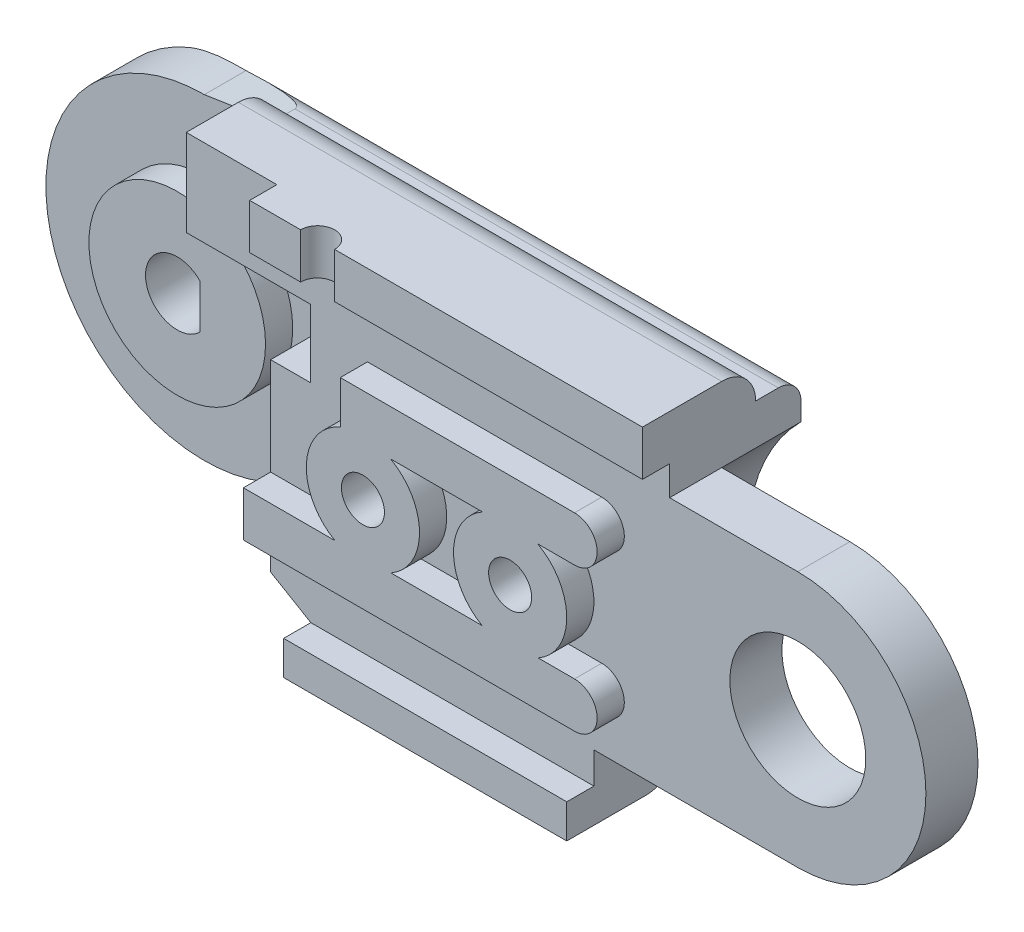
from build123d import *

# Parameters (mm, degrees)
BOSS_EXTRUDE1_DEPTH = 2
BOSS_EXTRUDE2_DEPTH = 1.5
BOSS_EXTRUDE3_DEPTH = 2.3
SKETCH6_W           = 5.48
SKETCH6_H           = 3
CUT_EXTRUDE1_DEPTH  = 3.8
SKETCH7_R           = 3
CUT_EXTRUDE2_DEPTH  = 3.3
SKETCH8_W           = 17.343145751
SKETCH8_H           = 2
SKETCH8_W_2         = 12.500252532
SKETCH8_H_2         = 1.5
BOSS_EXTRUDE4_DEPTH = 1.2
SKETCH9_R           = 2.5
BOSS_EXTRUDE5_DEPTH = 1.2
SKETCH10_R          = 0.95
CUT_EXTRUDE3_DEPTH  = 8.2
SKETCH11_R          = 2
CUT_EXTRUDE4_DEPTH  = 2.2
SKETCH12_R          = 3.9
BOSS_EXTRUDE6_DEPTH = 1.2
CUT_EXTRUDE5_DEPTH  = 3.2
FILLET1_R           = 1.5
FILLET2_R           = 1
SKETCH15_R          = 0.75
CUT_EXTRUDE6_DEPTH  = 4


with BuildPart() as part:
    # Sketch2 → Boss-Extrude1 (new body)
    with BuildSketch(Plane.XY):
        with BuildLine():
            Line((0, 7), (3, 7.456854249))
            Line((3, 7.456854249), (24.343145751, 7.456854249))
            Line((24.343145751, 7.456854249), (24.343145751, 5.656854249))
            ThreePointArc((24.343145751, 5.656854249), (22.60896374, 3.061467459), (22, 0))
            Line((22, 0), (21, -2.543145751))
            Line((21, -2.543145751), (21, -7.043145751))
            Line((21, -7.043145751), (8.499747468, -7.043145751))
            Line((8.499747468, -7.043145751), (4.949747468, -4.949747468))
            ThreePointArc((4.949747468, -4.949747468), (-6.467156728, -2.678784027), (0, 7))
        make_face()
    extrude(amount=BOSS_EXTRUDE1_DEPTH)

    # Sketch3 → Boss-Extrude2 (add)
    with BuildSketch(Plane.XY.offset(2)):
        with BuildLine():
            Line((24.343145751, 7.456854249), (24.343145751, 5.656854249))
            ThreePointArc((24.343145751, 5.656854249), (22.60896374, 3.061467459), (22, 0))
            Line((22, 0), (21, -2.543145751))
            Line((21, -2.543145751), (21, -7.043145751))
            Line((21, -7.043145751), (21, -8.543145751))
            Line((21, -8.543145751), (8.499747468, -8.543145751))
            Line((8.499747468, -8.543145751), (8.499747468, -7.043145751))
            Line((8.499747468, -7.043145751), (6.724747468, -5.996446609))
            Line((6.724747468, -5.996446609), (6.724747468, 2.126854249))
            Line((6.724747468, 2.126854249), (3, 2.126854249))
            Line((3, 2.126854249), (3, 7.456854249))
            Line((3, 7.456854249), (3, 8.956854249))
            Line((3, 8.956854249), (24.343145751, 8.956854249))
            Line((24.343145751, 8.956854249), (24.343145751, 7.456854249))
        make_face()
    extrude(amount=BOSS_EXTRUDE2_DEPTH)

    # Sketch5 → Boss-Extrude3 (add)
    with BuildSketch(Plane.XY.offset(3.5)):
        with BuildLine():
            Line((3, 7.5), (3, 2.126854249))
            Line((3, 2.126854249), (6.724747468, 2.126854249))
            Line((6.724747468, 2.126854249), (6.724747468, -5.996446609))
            Line((6.724747468, -5.996446609), (8.499747468, -7.043145751))
            Line((8.499747468, -7.043145751), (8.499747468, -8.543145751))
            Line((8.499747468, -8.543145751), (21, -8.543145751))
            Line((21, -8.543145751), (21, -5.656854249))
            Line((21, -5.656854249), (30.003145751, -5.656854249))
            ThreePointArc((30.003145751, -5.656854249), (35.66, 0), (30.003145751, 5.656854249))
            Line((30.003145751, 5.656854249), (24.343145751, 5.656854249))
            Line((24.343145751, 5.656854249), (24.343145751, 7.5))
            Line((24.343145751, 7.5), (24.343145751, 8.956854249))
            Line((24.343145751, 8.956854249), (3, 8.956854249))
            Line((3, 8.956854249), (3, 7.5))
        make_face()
    extrude(amount=BOSS_EXTRUDE3_DEPTH)

    # Sketch6 → Cut-Extrude1 (cut)
    with BuildSketch(Plane.XY.offset(5.8)):
        with Locations((5.74, 3.626854249)):
            Rectangle(SKETCH6_W, SKETCH6_H)
    extrude(amount=-CUT_EXTRUDE1_DEPTH, mode=Mode.SUBTRACT)

    # Sketch7 → Cut-Extrude2 (cut)
    with BuildSketch(Plane.XY.offset(5.8)):
        with Locations((30.003145751, 0)):
            Circle(SKETCH7_R)
    extrude(amount=-CUT_EXTRUDE2_DEPTH, mode=Mode.SUBTRACT)

    # Sketch8 → Boss-Extrude4 (add)
    with BuildSketch(Plane.XY.offset(5.8)):
        with Locations((15.671572876, 7.956854249)):
            Rectangle(SKETCH8_W, SKETCH8_H)
        with Locations((14.749873734, -7.793145751)):
            Rectangle(SKETCH8_W_2, SKETCH8_H_2)
        with BuildLine():
            Line((6.724747468, -4.172114809), (21.343145751, -4.172114809))
            ThreePointArc((21.343145751, -4.172114809), (22.343145751, -3.172114809), (21.343145751, -2.172114809))
            Line((21.343145751, -2.172114809), (6.724747468, -2.172114809))
            Line((6.724747468, -2.172114809), (6.724747468, -4.172114809))
        make_face()
        with BuildLine():
            Line((21.343145751, 4.180295218), (11, 4.180295218))
            Line((11, 4.180295218), (11, 2.180295218))
            Line((11, 2.180295218), (21.343145751, 2.180295218))
            ThreePointArc((21.343145751, 2.180295218), (22.343145751, 3.180295218), (21.343145751, 4.180295218))
        make_face()
    extrude(amount=BOSS_EXTRUDE4_DEPTH)

    # Sketch9 → Boss-Extrude5 (add)
    with BuildSketch(Plane.XY.offset(5.8)):
        with Locations((18.5, 0)):
            Circle(SKETCH9_R)
        with Locations((12, 0)):
            Circle(SKETCH9_R)
    extrude(amount=BOSS_EXTRUDE5_DEPTH)

    # Sketch10 → Cut-Extrude3 (cut)
    with BuildSketch(Plane.XY.offset(7)):
        with Locations((18.5, 0)):
            Circle(SKETCH10_R)
        with Locations((12, 0)):
            Circle(SKETCH10_R)
    extrude(amount=-CUT_EXTRUDE3_DEPTH, mode=Mode.SUBTRACT)

    # Sketch11 → Cut-Extrude4 (cut)
    with BuildSketch(Plane(origin=(0, 0, 0), x_dir=(-1, 0, 0), z_dir=(0, 0, -1))):
        with Locations((-12, 0)):
            Circle(SKETCH11_R)
        with Locations((-18.5, 0)):
            Circle(SKETCH11_R)
    extrude(amount=-CUT_EXTRUDE4_DEPTH, mode=Mode.SUBTRACT)

    # Sketch12 → Boss-Extrude6 (add)
    with BuildSketch(Plane.XY.offset(2)):
        Circle(SKETCH12_R)
    extrude(amount=BOSS_EXTRUDE6_DEPTH)

    # Sketch14 → Cut-Extrude5 (cut)
    with BuildSketch(Plane.XY.offset(3.2)):
        with BuildLine():
            Line((1, 0.979795897), (1, -0.979795897))
            ThreePointArc((1, -0.979795897), (-1.4, 0), (1, 0.979795897))
        make_face()
    extrude(amount=-CUT_EXTRUDE5_DEPTH, mode=Mode.SUBTRACT)

    # Fillet1
    fillet1_edges = [part.edges().sort_by_distance(p)[0] for p in [
        (13.671572875, 8.956854249, 2),
        (14.749873734, -8.543145751, 2),
    ]]
    fillet(fillet1_edges, radius=FILLET1_R - 0.0001)  # a hair under: the kernel refuses the full size

    # Fillet2
    fillet2_edges = [part.edges().sort_by_distance(p)[0] for p in [
        (14.749873734, -7.043145751, 0),
        (13.671572875, 7.456854249, 0),
    ]]
    fillet(fillet2_edges, radius=FILLET2_R)

    # Sketch15 → Cut-Extrude6 (cut)
    with BuildSketch(Plane.XZ.offset(-6.956854249)):
        with Locations((10, 7)):
            Circle(SKETCH15_R)
    extrude(amount=-CUT_EXTRUDE6_DEPTH, mode=Mode.SUBTRACT)


solid = part.part
